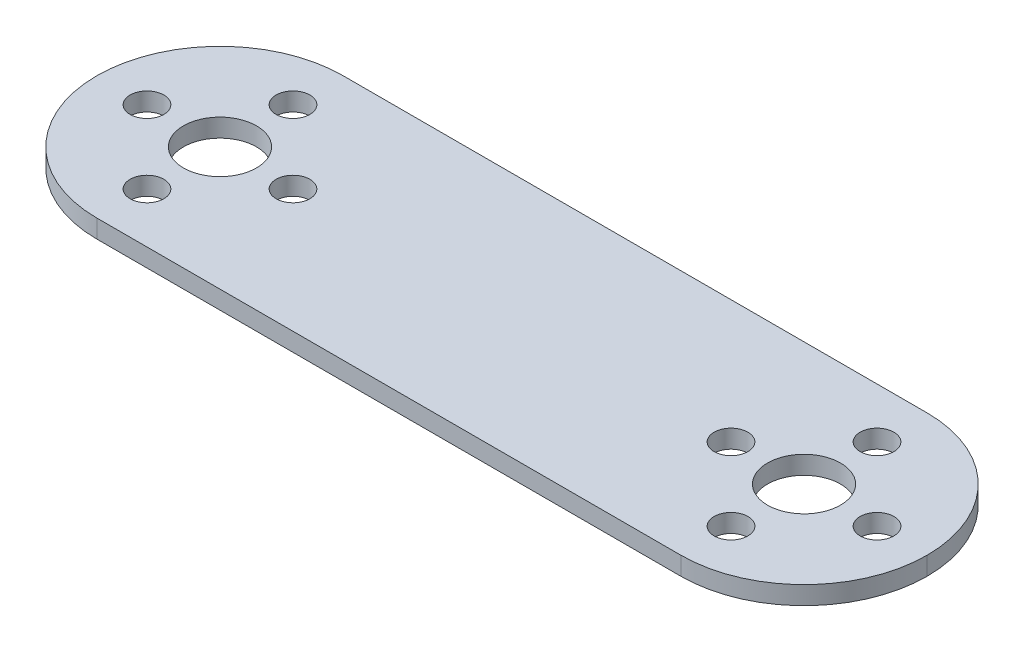
from build123d import *

# Parameters (mm, degrees)
SKETCH1_W                = 91
SKETCH1_H                = 27
EXTRUDE1_DEPTH           = 2
CUT_EXTRUDE1_START       = -2
CUT_EXTRUDE1_OUTLINE_R   = 4
CUT_EXTRUDE1_OUTLINE_R_2 = 1.85
CUT_EXTRUDE1_DEPTH       = 2
FILLET1_R                = 13.5
FILLET2_R                = 13.5
FILLET3_R                = 13.5
FILLET4_R                = 13.5


# Read off the part's stored shape, not the designer's step: Cut-Extrude1
with BuildPart() as part:
    # Sketch1 → Extrude1 (new body)
    with BuildSketch(Plane(origin=(0, 0, 0), x_dir=(1, 0, 0), z_dir=(0, 1, 0))):
        with Locations((45.5, 13.5)):
            Rectangle(SKETCH1_W, SKETCH1_H)
    extrude(amount=EXTRUDE1_DEPTH)

    # Cut-Extrude1 outline → Cut-Extrude1 (cut)
    with BuildSketch(Plane(origin=(0, 2, 0), x_dir=(1, 0, 0), z_dir=(0, 1, 0)).offset(CUT_EXTRUDE1_START)):
        with Locations((13.5, 13.5)):
            Circle(CUT_EXTRUDE1_OUTLINE_R)
        with Locations((21.5, 13.5)):
            Circle(CUT_EXTRUDE1_OUTLINE_R_2)
        with Locations((5.5, 13.5)):
            Circle(CUT_EXTRUDE1_OUTLINE_R_2)
        with Locations((13.5, 5.5)):
            Circle(CUT_EXTRUDE1_OUTLINE_R_2)
        with Locations((13.5, 21.5)):
            Circle(CUT_EXTRUDE1_OUTLINE_R_2)
        with Locations((77.5, 13.5)):
            Circle(CUT_EXTRUDE1_OUTLINE_R)
        with Locations((85.5, 13.5)):
            Circle(CUT_EXTRUDE1_OUTLINE_R_2)
        with Locations((69.5, 13.5)):
            Circle(CUT_EXTRUDE1_OUTLINE_R_2)
        with Locations((77.5, 5.5)):
            Circle(CUT_EXTRUDE1_OUTLINE_R_2)
        with Locations((77.5, 21.5)):
            Circle(CUT_EXTRUDE1_OUTLINE_R_2)
    extrude(amount=CUT_EXTRUDE1_DEPTH, mode=Mode.SUBTRACT)

    # Fillet1
    fillet1_edges = [part.edges().sort_by_distance(p)[0] for p in [
        (91, 1, 0),
    ]]
    fillet(fillet1_edges, radius=FILLET1_R)

    # Fillet2
    fillet2_edges = [part.edges().sort_by_distance(p)[0] for p in [
        (91, 1, -27),
    ]]
    fillet(fillet2_edges, radius=FILLET2_R - 0.0001)  # a hair under: the kernel refuses the full size

    # Fillet3
    fillet3_edges = [part.edges().sort_by_distance(p)[0] for p in [
        (0, 1, -27),
    ]]
    fillet(fillet3_edges, radius=FILLET3_R)

    # Fillet4
    fillet4_edges = [part.edges().sort_by_distance(p)[0] for p in [
        (0, 1, 0),
    ]]
    fillet(fillet4_edges, radius=FILLET4_R - 0.0001)  # a hair under: the kernel refuses the full size


solid = part.part
